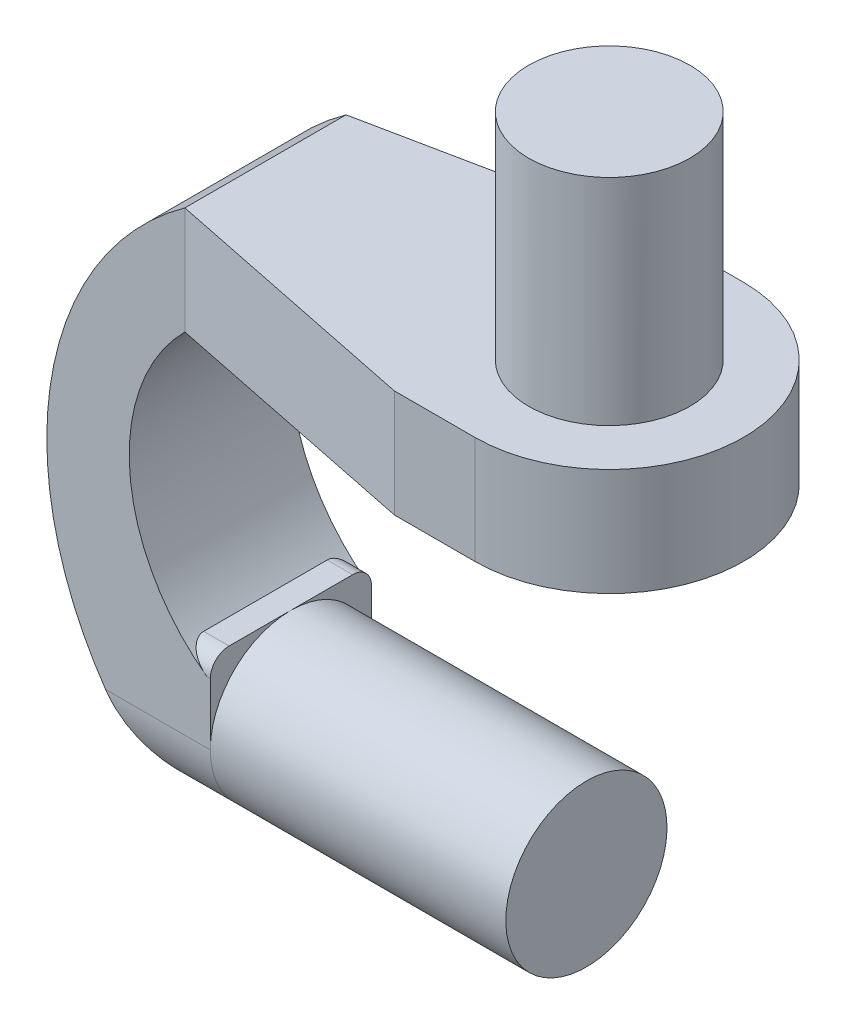
from build123d import *

# Parameters (mm, degrees)
BOSS_EXTRUDE1_DEPTH = 30
SKETCH2_R           = 15
BOSS_EXTRUDE2_DEPTH = 55
FILLET1_R           = 3.5
FILLET5_R           = 15
BOSS_EXTRUDE3_DEPTH = 20
SKETCH6_R           = 15
BOSS_EXTRUDE4_DEPTH = 40


with BuildPart() as part:
    # Sketch1 → Boss-Extrude1 (new body)
    with BuildSketch(Plane.XY):
        with BuildLine():
            Line((0, 0), (4.730174559, 0))
            Line((4.730174559, 0), (4.730174559, -30))
            Line((4.730174559, -30), (0, -30))
            ThreePointArc((0, -30), (-25.69148146, 20), (0, 70))
            Line((0, 70), (0, 50))
            ThreePointArc((0, 50), (-10.355339059, 25), (0, 0))
        make_face()
    extrude(amount=BOSS_EXTRUDE1_DEPTH)

    # Sketch2 → Boss-Extrude2 (add)
    with BuildSketch(Plane(origin=(4.730174559, 0, 0), x_dir=(0, 0, -1), z_dir=(1, 0, 0))):
        with Locations(Location((-15, -15, 0), (0, 0, 90))):
            Circle(SKETCH2_R)
    extrude(amount=BOSS_EXTRUDE2_DEPTH)

    # Fillet1
    fillet1_edges = [part.edges().sort_by_distance(p)[0] for p in [
        (2.36508728, 0, 30),
        (2.36508728, 0, 0),
    ]]
    fillet(fillet1_edges, radius=FILLET1_R)

    # Fillet5
    fillet5_edges = [part.edges().sort_by_distance(p)[0] for p in [
        (2.36508728, -30, 0),
        (2.36508728, -30, 30),
    ]]
    fillet(fillet5_edges, radius=FILLET5_R - 0.0001)  # a hair under: the kernel refuses the full size

    # Sketch5 → Boss-Extrude3 (add)
    with BuildSketch(Plane(origin=(0, 70, 0), x_dir=(0, 0, -1), z_dir=(0, 1, 0))):
        with BuildLine():
            Line((-30, 0), (-40, -48.989794856))
            Line((-40, -48.989794856), (-40, -63.989794856))
            ThreePointArc((-40, -63.989794856), (-15, -88.989794856), (10, -63.989794856))
            Line((10, -63.989794856), (10, -48.989794856))
            Line((10, -48.989794856), (0, 0))
            Line((0, 0), (-30, 0))
        make_face()
    extrude(amount=-BOSS_EXTRUDE3_DEPTH)

    # Sketch6 → Boss-Extrude4 (add)
    with BuildSketch(Plane(origin=(0, 70, 0), x_dir=(1, 0, 0), z_dir=(0, 1, 0))):
        with Locations(Location((63.989794856, -15, 0), (0, 0, 90))):
            Circle(SKETCH6_R)
    extrude(amount=BOSS_EXTRUDE4_DEPTH)


solid = part.part
